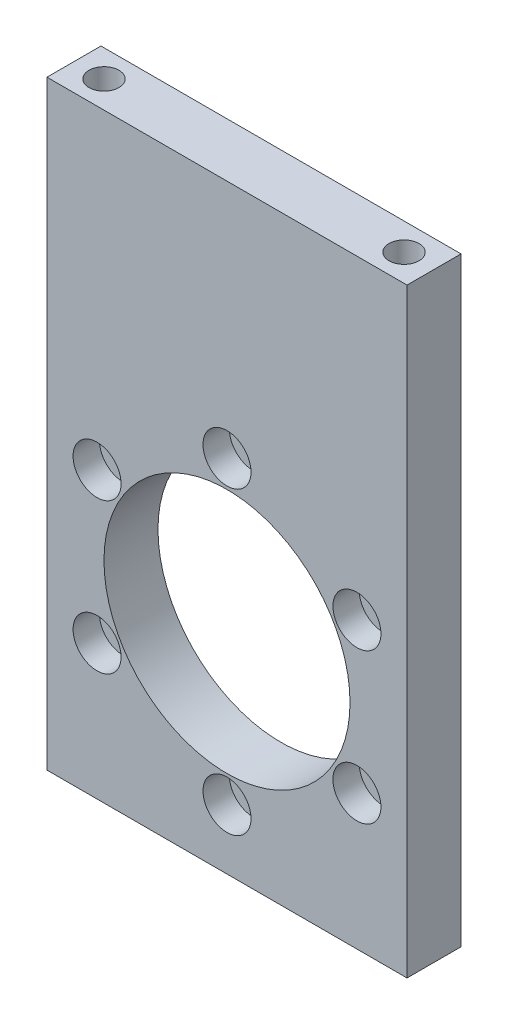
from build123d import *

# Parameters (mm, degrees)
SKETCH1_W                                           = 60
SKETCH1_H                                           = 100
BOSS_EXTRUDE1_DEPTH                                 = 4.5
CUT_EXTRUDE2_DEPTH                                  = 117.705826761
CUT_EXTRUDE2_DEPTH_BACK                             = 117.705826761
SKETCH3_R                                           = 20.5
M6_TAPPED_HOLE1_AT_2_COUNT                          = 2
M6_TAPPED_HOLE1_AT_2_PITCH                          = 50
CBORE_FOR_M4_HEX_SOCKET_HEAD_CAP_SCREW1_D           = 4.3
CBORE_FOR_M4_HEX_SOCKET_HEAD_CAP_SCREW1_CBORE_D     = 8
CBORE_FOR_M4_HEX_SOCKET_HEAD_CAP_SCREW1_CBORE_DEPTH = 4.4
CIRPATTERN1_COUNT                                   = 6


with BuildPart() as part:
    # Sketch1 → Boss-Extrude1 (new, symmetric)
    with BuildSketch(Plane.XY):
        with Locations((30, 50)):
            Rectangle(SKETCH1_W, SKETCH1_H)
    extrude(amount=BOSS_EXTRUDE1_DEPTH, both=True)

    # Sketch3 → Cut-Extrude2 (cut, two sides: drawn at the far end of the back side and taken through both)
    with BuildSketch(Plane.XY.offset(-CUT_EXTRUDE2_DEPTH_BACK)):
        with Locations((30, 35)):
            Circle(SKETCH3_R)
    extrude(amount=CUT_EXTRUDE2_DEPTH + CUT_EXTRUDE2_DEPTH_BACK, mode=Mode.SUBTRACT)

    # Sketch5 → M6 Tapped Hole1 (revolve, cut)
    with BuildSketch(Plane(origin=(55, 0, 0), x_dir=(0, 0, -1), z_dir=(1, 0, 0))):
        Polygon((0, 0), (0, 16.502151548), (2.5, 15), (2.5, 0), align=None)
    m6_tapped_hole1 = revolve(axis=Axis((55, -6.35, 0), (0, 1, 0)), mode=Mode.SUBTRACT)

    # M6 Tapped Hole1 at 2: M6 Tapped Hole1 ×2
    with Locations(*[(-i * M6_TAPPED_HOLE1_AT_2_PITCH, 0, 0) for i in range(1, M6_TAPPED_HOLE1_AT_2_COUNT)]):
        add(m6_tapped_hole1, mode=Mode.SUBTRACT)

    # Mirror1: M6 Tapped Hole1 across plane
    add(m6_tapped_hole1.mirror(Plane.ZX.offset(50)), mode=Mode.SUBTRACT)

    # Mirror1 copy 1 sketch → Mirror1 copy 1 (revolve, cut)
    with BuildSketch(Plane(origin=(5, 100, 0), x_dir=(0, 0, -1), z_dir=(1, 0, 0))):
        Polygon((0, 0), (0, -16.502151548), (2.5, -15), (2.5, 0), align=None)
    revolve(axis=Axis((5, 106.35, 0), (0, 1, 0)), mode=Mode.SUBTRACT)

    # CBORE for M4 Hex Socket Head Cap Screw1 (through all)
    with Locations(Plane.XY.offset(4.5)):
        with Locations((30, 60)):
            cbore_for_m4_hex_socket_head_cap_screw1 = CounterBoreHole(CBORE_FOR_M4_HEX_SOCKET_HEAD_CAP_SCREW1_D / 2, CBORE_FOR_M4_HEX_SOCKET_HEAD_CAP_SCREW1_CBORE_D / 2, CBORE_FOR_M4_HEX_SOCKET_HEAD_CAP_SCREW1_CBORE_DEPTH)

    # CirPattern1: CBORE for M4 Hex Socket Head Cap Screw1 ×6 about axis
    cirpattern1_axis = Axis((30, 35, -4.5), (0, 0, 1))
    for i in range(1, CIRPATTERN1_COUNT):
        add(cbore_for_m4_hex_socket_head_cap_screw1.rotate(cirpattern1_axis, i * 360 / CIRPATTERN1_COUNT), mode=Mode.SUBTRACT)


solid = part.part
